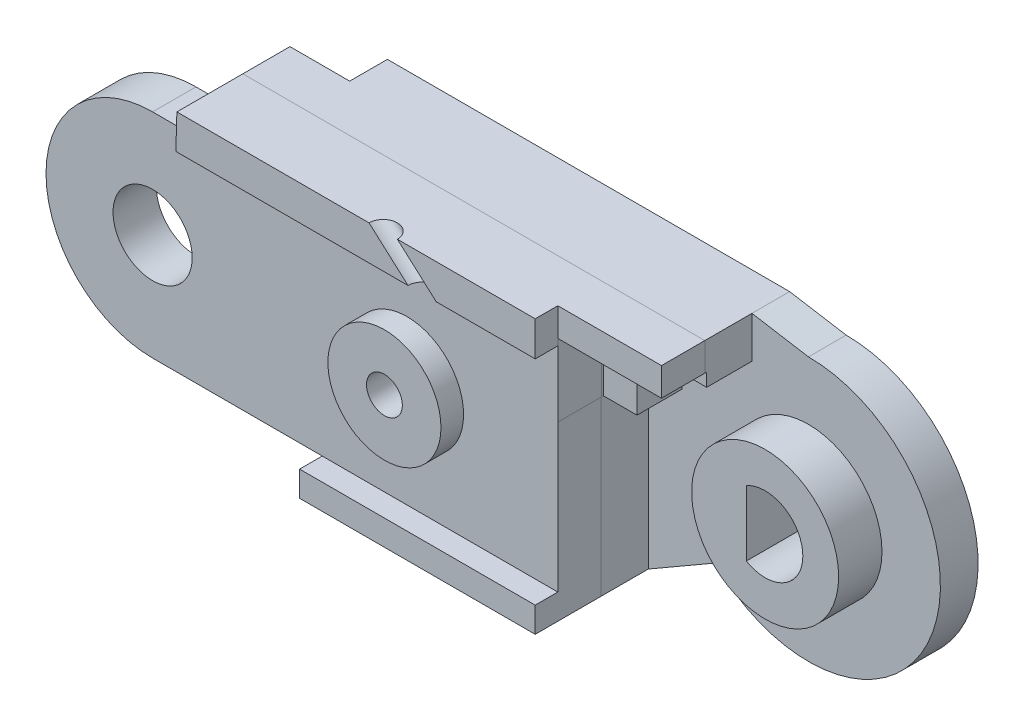
from build123d import *

# Parameters (mm, degrees)
BOSS_EXTRUDE1_DEPTH  = 2
BOSS_EXTRUDE6_DEPTH  = 2.5
CUT_EXTRUDE6_DEPTH   = 2.4
BOSS_EXTRUDE14_DEPTH = 2.3
SKETCH32_R           = 2.1
CUT_EXTRUDE7_DEPTH   = 2.3
SKETCH33_W           = 12.5
SKETCH33_H           = 1.343145751
BOSS_EXTRUDE15_DEPTH = 1.2
SKETCH35_W           = 5.479645997
SKETCH35_H           = 3.827993755
CUT_EXTRUDE8_DEPTH   = 2.4
SKETCH36_W           = 3.7
SKETCH36_H           = 1.827993755
CUT_EXTRUDE9_DEPTH   = 2.4
SKETCH37_R           = 3.9
BOSS_EXTRUDE16_DEPTH = 2.3
CUT_EXTRUDE10_DEPTH  = 38.996578793
SKETCH43_R           = 3
BOSS_EXTRUDE17_DEPTH = 1.2
SKETCH44_R           = 0.95
CUT_EXTRUDE11_DEPTH  = 39.590802013
SKETCH45_R           = 2
CUT_EXTRUDE12_DEPTH  = 3.2
SKETCH47_R           = 0.75
CUT_EXTRUDE13_DEPTH  = 5.2


with BuildPart() as part:
    # Sketch3 → Boss-Extrude1 (new body)
    with BuildSketch(Plane.XY):
        with BuildLine():
            Line((8, 0), (9, -2.5))
            Line((9, -2.5), (9, -7))
            Line((9, -7), (21.5, -7))
            Line((21.5, -7), (25.050252532, -4.949747468))
            ThreePointArc((25.050252532, -4.949747468), (36.467156728, -2.678784027), (30, 7))
            Line((30, 7), (27, 7.5))
            Line((27, 7.5), (5.656854249, 7.5))
            Line((5.656854249, 7.5), (5.656854249, 5.656854249))
            ThreePointArc((5.656854249, 5.656854249), (7.39103626, 3.061467459), (8, 0))
        make_face()
    extrude(amount=BOSS_EXTRUDE1_DEPTH)

    # Sketch22 → Boss-Extrude6 (add)
    with BuildSketch(Plane.XY.offset(2)):
        with BuildLine():
            Line((5.656854249, 5.656854249), (2.486790148, 5.656854249))
            Line((2.486790148, 5.656854249), (2.486790148, 7.5))
            Line((2.486790148, 7.5), (5.656854249, 7.5))
            Line((5.656854249, 7.5), (21.5, 7.5))
            Line((21.5, 7.5), (27, 7.5))
            Line((27, 7.5), (27, 2.172006245))
            Line((27, 2.172006245), (21.5, 2.172006245))
            Line((21.5, 2.172006245), (21.5, 0))
            Line((21.5, 0), (21.5, -7))
            Line((21.5, -7), (9, -7))
            Line((9, -7), (9, -2.5))
            Line((9, -2.5), (8, 0))
            ThreePointArc((8, 0), (7.39103626, 3.061467459), (5.656854249, 5.656854249))
        make_face()
    extrude(amount=BOSS_EXTRUDE6_DEPTH)

    # Sketch26 → Cut-Extrude6 (cut)
    with BuildSketch(Plane.XY.offset(2)):
        Polygon((18.098080448, 5.3), (2.530052458, 5.3), (2.530052458, 4), (18.098080448, 4), (27, 4), (27, 5.3), align=None)
    extrude(amount=CUT_EXTRUDE6_DEPTH, mode=Mode.SUBTRACT)


with BuildPart() as body_2:
    # Sketch31 → Boss-Extrude14 (new body)
    with BuildSketch(Plane.XY.offset(4.5)):
        with BuildLine():
            Line((2.432688066, 5.656854249), (0, 5.656854249))
            ThreePointArc((0, 5.656854249), (-5.656854249, 0), (0, -5.656854249))
            Line((0, -5.656854249), (9, -5.656854249))
            Line((9, -5.656854249), (9, -7))
            Line((9, -7), (21.5, -7))
            Line((21.5, -7), (21.5, 2.172006245))
            Line((21.5, 2.172006245), (27, 2.172006245))
            Line((27, 2.172006245), (27, 7.5))
            Line((27, 7.5), (21.5, 7.5))
            Line((21.5, 7.5), (2.486790148, 7.5))
            Line((2.486790148, 7.5), (2.432688066, 5.656854249))
        make_face()
    extrude(amount=BOSS_EXTRUDE14_DEPTH)

    # Sketch32 → Cut-Extrude7 (cut)
    with BuildSketch(Plane.XY.offset(6.8)):
        Circle(SKETCH32_R)
    extrude(amount=-CUT_EXTRUDE7_DEPTH, mode=Mode.SUBTRACT)

    # Sketch33 → Boss-Extrude15 (add)
    with BuildSketch(Plane.XY.offset(6.8)):
        Polygon((2.486790148, 7.5), (21.5, 7.5), (21.5, 5.656854249), (2.432688066, 5.656854249), align=None)
        with Locations((15.25, -6.328427125)):
            Rectangle(SKETCH33_W, SKETCH33_H)
    extrude(amount=BOSS_EXTRUDE15_DEPTH)


with BuildPart() as cut_extrude8_tool:
    # Sketch35 → Cut-Extrude8 (new body)
    with BuildSketch(Plane.XY.offset(6.8)):
        with Locations((24.260177002, 4.086003123)):
            Rectangle(SKETCH35_W, SKETCH35_H)
    extrude(amount=-CUT_EXTRUDE8_DEPTH)


with BuildPart() as part_1:
    add(part.part)

    # Cut-Extrude8: cut by cut_extrude8_tool
    add(cut_extrude8_tool.part, mode=Mode.SUBTRACT)

    # Sketch36 → Cut-Extrude9 (cut)
    with BuildSketch(Plane.XY.offset(4.4)):
        with Locations((25.15, 3.086003123)):
            Rectangle(SKETCH36_W, SKETCH36_H)
    extrude(amount=-CUT_EXTRUDE9_DEPTH, mode=Mode.SUBTRACT)

    # Sketch37 → Boss-Extrude16 (add)
    with BuildSketch(Plane.XY.offset(2)):
        with Locations((30, 0)):
            Circle(SKETCH37_R)
    extrude(amount=BOSS_EXTRUDE16_DEPTH)

    # Sketch39 → Cut-Extrude10 (cut, through all)
    with BuildSketch(Plane.XY.offset(4.3)):
        with BuildLine():
            Line((29, 1.732050808), (29, -1.732050808))
            ThreePointArc((29, -1.732050808), (32, 0), (29, 1.732050808))
        make_face()
    extrude(amount=-CUT_EXTRUDE10_DEPTH, mode=Mode.SUBTRACT)


with BuildPart() as body_2_1:
    add(body_2.part)

    # Cut-Extrude8: cut by cut_extrude8_tool
    add(cut_extrude8_tool.part, mode=Mode.SUBTRACT)

    # Sketch43 → Boss-Extrude17 (add)
    with BuildSketch(Plane.XY.offset(6.8)):
        with Locations((13.5, 0)):
            Circle(SKETCH43_R)
    extrude(amount=BOSS_EXTRUDE17_DEPTH)


with BuildPart() as cut_extrude11_tool:
    # Sketch44 → Cut-Extrude11 (new, through all)
    with BuildSketch(Plane.XY.offset(8)):
        with Locations((13.5, 0)):
            Circle(SKETCH44_R)
    extrude(amount=-CUT_EXTRUDE11_DEPTH)


with BuildPart() as part_2:
    add(part_1.part)

    # Cut-Extrude11: cut by cut_extrude11_tool
    add(cut_extrude11_tool.part, mode=Mode.SUBTRACT)

    # Sketch45 → Cut-Extrude12 (cut)
    with BuildSketch(Plane(origin=(0, 0, 0), x_dir=(-1, 0, 0), z_dir=(0, 0, -1))):
        with Locations((-13.5, 0)):
            Circle(SKETCH45_R)
    extrude(amount=-CUT_EXTRUDE12_DEPTH, mode=Mode.SUBTRACT)


with BuildPart() as body_2_2:
    add(body_2_1.part)

    # Cut-Extrude11: cut by cut_extrude11_tool
    add(cut_extrude11_tool.part, mode=Mode.SUBTRACT)

    # Sketch47 → Cut-Extrude13 (cut, along a direction that is not the sketch's normal)
    with BuildSketch(Plane.XZ.offset(-5.656854249)):
        with Locations((15.5, 8)):
            Circle(SKETCH47_R)
    extrude(amount=-CUT_EXTRUDE13_DEPTH, dir=(0.7462461216224772, -0.6656701329963746, 0), mode=Mode.SUBTRACT)


solid = Compound([part_2.part, body_2_2.part])
